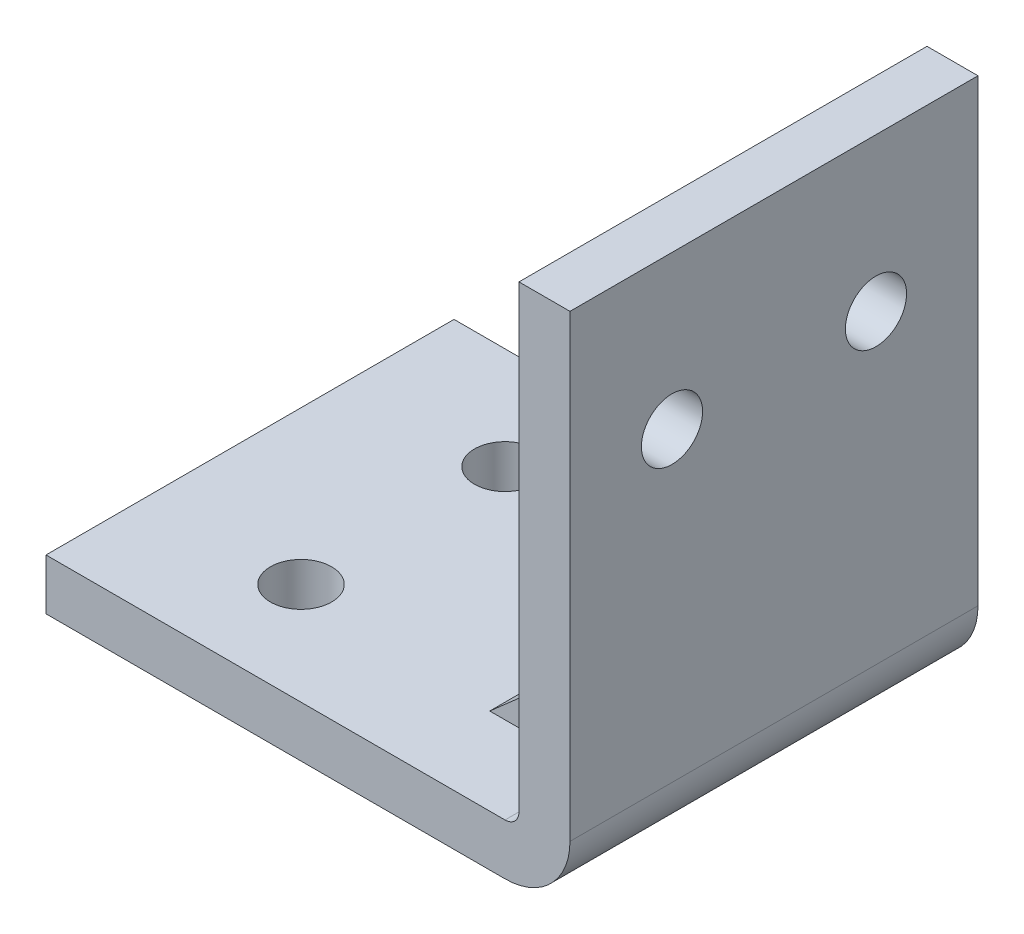
from build123d import *

# Parameters (mm, degrees)
SKETCH1_W                                  = 100
SKETCH1_H                                  = 40
BOSS_EXTRUDE1_DEPTH                        = 5
SKETCH2_R                                  = 3
CUT_EXTRUDE1_DEPTH                         = 55.083269132
MIRROR1_AT_THE_SECOND_PLANE_COPY_1_SKETC_R = 3
MIRROR1_AT_THE_SECOND_PLANE_COPY_1_DEPTH   = 55.083269132
FLEX1_START                                = 1.366197724
FLEX1_OUTLINE_W                            = 5
FLEX1_OUTLINE_H                            = 40
FLEX1_DEPTH                                = 48.633802276
FLEX1_START_2                              = -3.633802276
FLEX1_2_OUTLINE_W                          = 46.366197724
FLEX1_2_OUTLINE_H                          = 40
FLEX1_2_OUTLINE_R                          = 3
FLEX1_2_DEPTH                              = 3.907802276
FLEX1_START_3                              = -5
FLEX1_3_OUTLINE_W                          = 46.366197724
FLEX1_3_OUTLINE_H                          = 40
FLEX1_3_OUTLINE_R                          = 3
FLEX1_3_DEPTH                              = 6.366197724
FLEX1_START_4                              = -20
FLEX1_4_DEPTH                              = 40
RIB1_REACH                                 = 79.708
SKETCH3_WALL_W                             = 172.55443254
SKETCH3_WALL_H                             = 3


with BuildPart() as part:
    # Sketch1 → Boss-Extrude1 (new body)
    with BuildSketch(Plane(origin=(0, 0, 0), x_dir=(1, 0, 0), z_dir=(0, 1, 0))):
        Rectangle(SKETCH1_W, SKETCH1_H)
    extrude(amount=BOSS_EXTRUDE1_DEPTH)

    # Sketch2 → Cut-Extrude1 (cut, through all)
    with BuildSketch(Plane(origin=(0, 5, 0), x_dir=(1, 0, 0), z_dir=(0, 1, 0))):
        with Locations(Location((-35, 10, 0), (0, 0, 270))):
            Circle(SKETCH2_R)
    cut_extrude1 = extrude(amount=-CUT_EXTRUDE1_DEPTH, mode=Mode.SUBTRACT)

    # Mirror1: Cut-Extrude1 across plane
    add(cut_extrude1.mirror(Plane.XY), mode=Mode.SUBTRACT)

    # Mirror1 at the second plane: Cut-Extrude1 across plane
    add(cut_extrude1.mirror(Plane(origin=(0, 0, 0), x_dir=(0, 0, 1), z_dir=(1, 0, 0))), mode=Mode.SUBTRACT)

    # Mirror1 at the second plane copy 1 sketc → Mirror1 at the second plane copy 1 (cut, through all)
    with BuildSketch(Plane(origin=(0, 5, 0), x_dir=(-1, 0, 0), z_dir=(0, 1, 0))):
        with Locations(Location((-35, 10, 0), (0, 0, 270))):
            Circle(MIRROR1_AT_THE_SECOND_PLANE_COPY_1_SKETC_R)
    extrude(amount=-MIRROR1_AT_THE_SECOND_PLANE_COPY_1_DEPTH, mode=Mode.SUBTRACT)

    # Flex1: read off the stored shape, not the designer's step
    # Flex1 outline → Flex1 (cut)
    with BuildSketch(Plane.YZ.offset(FLEX1_START)):
        with Locations((2.5, 0)):
            Rectangle(FLEX1_OUTLINE_W, FLEX1_OUTLINE_H)
    extrude(amount=FLEX1_DEPTH, mode=Mode.SUBTRACT)

    # Flex1 2 outline → Flex1 2 (add)
    with BuildSketch(Plane.YZ.offset(FLEX1_START_2)):
        with Locations((28.183098862, 0)):
            Rectangle(FLEX1_2_OUTLINE_W, FLEX1_2_OUTLINE_H)
        with Locations((36.366197724, -10)):
            Circle(FLEX1_2_OUTLINE_R, mode=Mode.SUBTRACT)
        with Locations((36.366197724, 10)):
            Circle(FLEX1_2_OUTLINE_R, mode=Mode.SUBTRACT)
    extrude(amount=FLEX1_2_DEPTH)

    # Flex1 3 outline → Flex1 3 (add)
    with BuildSketch(Plane.YZ.offset(FLEX1_START_3)):
        with Locations((28.183098862, 0)):
            Rectangle(FLEX1_3_OUTLINE_W, FLEX1_3_OUTLINE_H)
        with Locations((36.366197724, -10)):
            Circle(FLEX1_3_OUTLINE_R, mode=Mode.SUBTRACT)
        with Locations((36.366197724, 10)):
            Circle(FLEX1_3_OUTLINE_R, mode=Mode.SUBTRACT)
    extrude(amount=FLEX1_3_DEPTH)

    # Flex1 4 outline → Flex1 4 (cut)
    with BuildSketch(Plane.XY.offset(FLEX1_START_4)):
        with BuildLine():
            Line((1.366197724, 0), (1.366197724, 6.366197724))
            ThreePointArc((1.366197724, 6.366197724), (-0.498418419, 1.864616143), (-5, 0))
            Line((-5, 0), (1.366197724, 0))
        make_face()
        with BuildLine():
            ThreePointArc((-5, 5), (-4.033952325, 5.400150049), (-3.633802276, 6.366197724))
            Line((-3.633802276, 6.366197724), (-3.633802276, 51.366197724))
            Line((-3.633802276, 51.366197724), (-5, 51.366197724))
            Line((-5, 51.366197724), (-5, 5))
        make_face()
    extrude(amount=FLEX1_4_DEPTH, mode=Mode.SUBTRACT)

    # Sketch3 wall → Rib1 (add, up to next)
    with BuildSketch(Plane(origin=(-9.316901138, 10, 10), x_dir=(-0.750787351307, -0.660543982727, 0), z_dir=(0.660543982727, -0.750787351307, 0)), mode=Mode.PRIVATE) as rib1_sk1:
        Rectangle(SKETCH3_WALL_W, SKETCH3_WALL_H)
    rib1_tool1 = extrude(rib1_sk1.sketch, amount=RIB1_REACH, mode=Mode.PRIVATE) - part.part
    rib1 = rib1_tool1.solids().sort_by_distance((-9.316901138, 10, 10))[0]
    add(rib1)

    # Mirror2: Rib1 across plane
    add(rib1.mirror(Plane.XY))


solid = part.part
